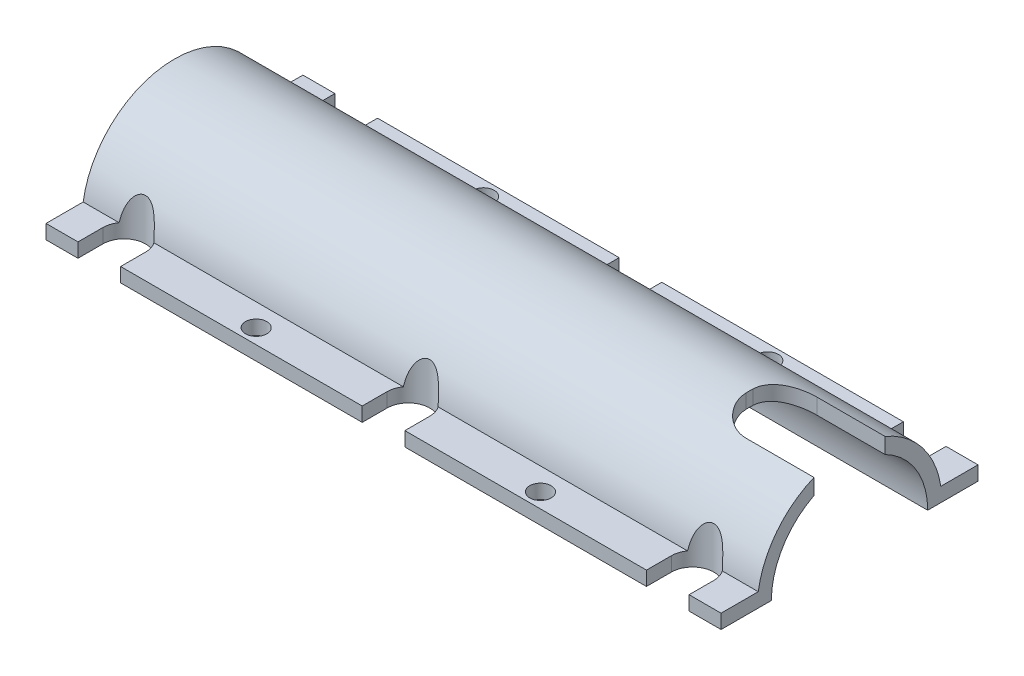
from build123d import *

# Parameters (mm, degrees)
EXTRUDE_1_DEPTH          = 95
CUT_EXTRUDE_1_DEPTH      = 98.328840189
CUT_EXTRUDE_1_DEPTH_BACK = 98.328840189
SKETCH_2_R               = 1.5
CUT_EXTRUDE_2_DEPTH      = 98.575312762


with BuildPart() as part:
    # Эскиз1 → Бобышка-Вытянуть1 (new body)
    with BuildSketch(Plane(origin=(0, 0, 0), x_dir=(0, 0, -1), z_dir=(1, 0, 0))):
        with BuildLine():
            Line((11, 0), (18.079487192, 0))
            Line((18.079487192, 0), (18.079487192, 2))
            Line((18.079487192, 2), (12.848104212, 2))
            ThreePointArc((12.848104212, 2), (0.000220895, 13.002837452), (-12.848036252, 2.000436531))
            Line((-12.848036252, 2.000436531), (-18.079487192, 2))
            Line((-18.079487192, 2), (-18.079487192, 0))
            Line((-18.079487192, 0), (-11, 0))
            ThreePointArc((-11, 0), (0, 11), (11, 0))
        make_face()
    extrude(amount=EXTRUDE_1_DEPTH)

    # Эскиз2 → Вырез-Вытянуть1 (cut, two sides: drawn at the far end of the back side and taken through both)
    with BuildSketch(Plane(origin=(0, 2.001508604, 0.000167013), x_dir=(1, 0, 0), z_dir=(0, 0.9999999965185792, 8.344364312112642e-05)).offset(-CUT_EXTRUDE_1_DEPTH_BACK)):
        with Locations((27.5, -16)):
            Circle(SKETCH_2_R)
        with Locations((67.5, -16)):
            Circle(SKETCH_2_R)
        with Locations((67.5, 16)):
            Circle(SKETCH_2_R)
        with Locations((27.5, 16)):
            Circle(SKETCH_2_R)
        with BuildLine():
            Line((4.5, -14.579320241), (4.5, -18.29882224))
            Line((4.5, -18.29882224), (10.5, -18.29882224))
            Line((10.5, -18.29882224), (10.5, -14.579320241))
            ThreePointArc((10.5, -14.579320241), (7.5, -11.579320241), (4.5, -14.579320241))
        make_face()
        with BuildLine():
            Line((50.5, -18.29882224), (50.5, -14.579320241))
            ThreePointArc((50.5, -14.579320241), (47.5, -11.579320241), (44.5, -14.579320241))
            Line((44.5, -14.579320241), (44.5, -18.29882224))
            Line((44.5, -18.29882224), (50.5, -18.29882224))
        make_face()
        with BuildLine():
            Line((90.5, -18.29882224), (90.5, -14.579320241))
            ThreePointArc((90.5, -14.579320241), (87.5, -11.579320241), (84.5, -14.579320241))
            Line((84.5, -14.579320241), (84.5, -18.29882224))
            Line((84.5, -18.29882224), (90.5, -18.29882224))
        make_face()
        with BuildLine():
            Line((84.5, 18.29882224), (90.5, 18.29882224))
            Line((90.5, 18.29882224), (90.5, 14.579320241))
            ThreePointArc((90.5, 14.579320241), (87.5, 11.579320241), (84.5, 14.579320241))
            Line((84.5, 14.579320241), (84.5, 18.29882224))
        make_face()
        with BuildLine():
            Line((44.5, 18.29882224), (50.5, 18.29882224))
            Line((50.5, 18.29882224), (50.5, 14.579320241))
            ThreePointArc((50.5, 14.579320241), (47.5, 11.579320241), (44.5, 14.579320241))
            Line((44.5, 14.579320241), (44.5, 18.29882224))
        make_face()
        with BuildLine():
            Line((4.5, 18.29882224), (10.5, 18.29882224))
            Line((10.5, 18.29882224), (10.5, 14.579320241))
            ThreePointArc((10.5, 14.579320241), (7.5, 11.579320241), (4.5, 14.579320241))
            Line((4.5, 14.579320241), (4.5, 18.29882224))
        make_face()
    extrude(amount=CUT_EXTRUDE_1_DEPTH + CUT_EXTRUDE_1_DEPTH_BACK, mode=Mode.SUBTRACT)

    # Эскиз3 → Вырез-Вытянуть2 (cut, through all)
    with BuildSketch(Plane.XZ):
        with BuildLine():
            Line((85.409616901, 5), (95, 5))
            Line((95, 5), (95, -5))
            Line((95, -5), (85.409616901, -5))
            ThreePointArc((85.409616901, -5), (82.227636386, -3.681980515), (80.909616901, -0.5))
            Line((80.909616901, -0.5), (80.909616901, 0.5))
            ThreePointArc((80.909616901, 0.5), (82.227636386, 3.681980515), (85.409616901, 5))
        make_face()
    extrude(amount=-CUT_EXTRUDE_2_DEPTH, mode=Mode.SUBTRACT)


solid = part.part
